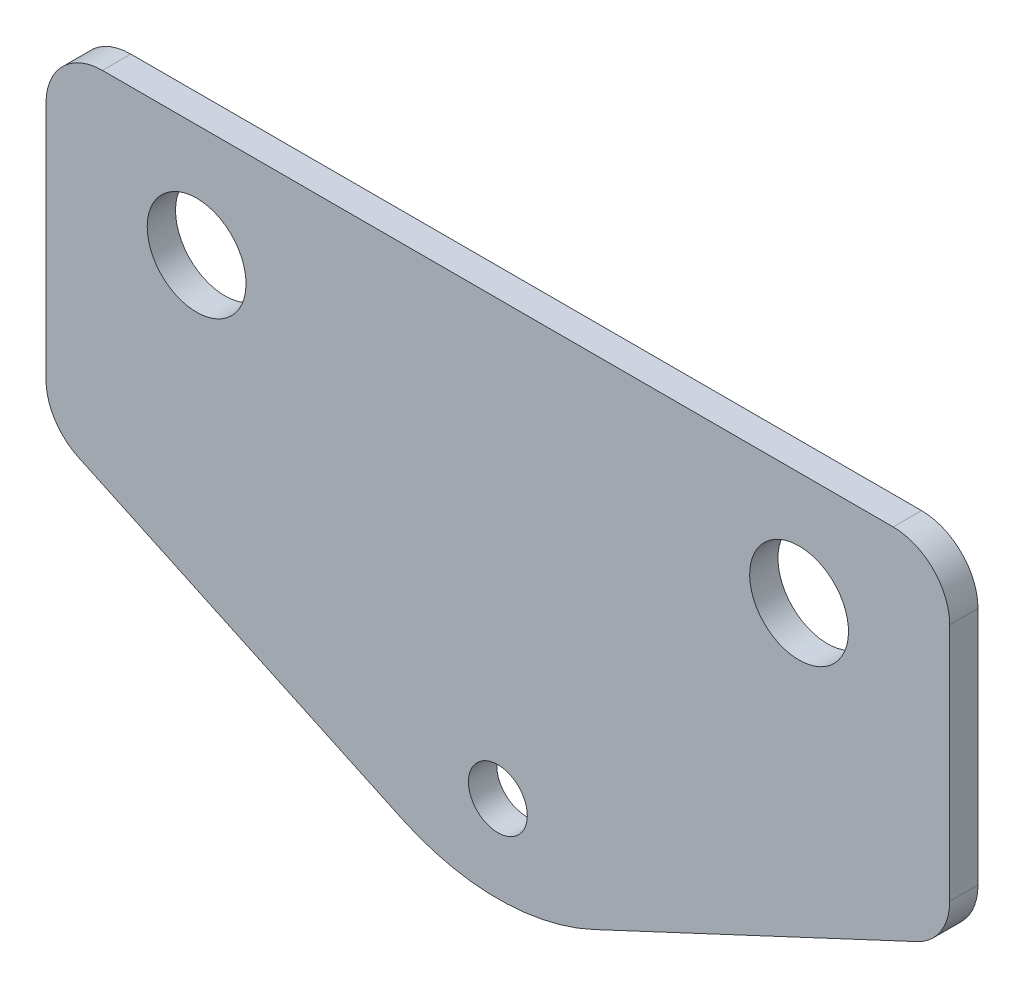
from build123d import *

# Parameters (mm, degrees)
BASE_FLANGE1_DEPTH    = 76.2
CUT_EXTRUDE1_DEPTH    = 100.11903454
SKETCH4_R             = 8.334375
CUT_EXTRUDE2_DEPTH    = 100.669004783
FILLET1_R             = 9.525
FLAT_PATTERN1_START   = 4.7752
FLAT_PATTERN1_DEPTH   = 41.610875653
FLAT_PATTERN1_2_DEPTH = 4.7752
SKETCH6_R             = 4.9657
CUT_EXTRUDE4_DEPTH    = 89.346165933


# Read off the part's stored shape, not the designer's step: Flat-Pattern1
# Sheet-metal steps are written as plain solids
with BuildPart() as part:
    # Sketch1 → Base-Flange1 (new, symmetric)
    with BuildSketch(Plane(origin=(0, 0, 0), x_dir=(0, 0, -1), z_dir=(1, 0, 0))):
        with BuildLine():
            Line((0, 44.45), (0, 3.610410109))
            ThreePointArc((0, 3.610410109), (-0.932488229, 0.652935287), (-3.392675737, -1.234832983))
            Line((-3.392675737, -1.234832983), (-44.752861065, -16.288709326))
            Line((-44.752861065, -16.288709326), (-46.386075653, -11.801489123))
            Line((-46.386075653, -11.801489123), (-5.025890325, 3.25238722))
            ThreePointArc((-5.025890325, 3.25238722), (-4.844103071, 3.391877486), (-4.7752, 3.610410109))
            Line((-4.7752, 3.610410109), (-4.7752, 44.45))
            Line((-4.7752, 44.45), (0, 44.45))
        make_face()
    extrude(amount=BASE_FLANGE1_DEPTH, both=True)

    # Sketch3 → Cut-Extrude1 (cut, through all)
    with BuildSketch(Plane(origin=(0, -7.918276224, 35.717035898), x_dir=(1, 0, 0), z_dir=(0, -0.9396926207859093, -0.3420201433256664))):
        with BuildLine():
            Line((-76.2, -20.318857819), (-16.138866151, 7.766752504))
            ThreePointArc((-16.138866151, 7.766752504), (0, 11.353754961), (16.138866151, 7.766752504))
            Line((16.138866151, 7.766752504), (76.2, -20.318857819))
            Line((76.2, -20.318857819), (88.840930233, -20.318857819))
            Line((88.840930233, -20.318857819), (88.840930233, 63.227466393))
            Line((88.840930233, 63.227466393), (-88.840930233, 63.227466393))
            Line((-88.840930233, 63.227466393), (-88.840930233, -20.318857819))
            Line((-88.840930233, -20.318857819), (-76.2, -20.318857819))
        make_face()
    extrude(amount=CUT_EXTRUDE1_DEPTH, mode=Mode.SUBTRACT)

    # Sketch4 → Cut-Extrude2 (cut, through all)
    with BuildSketch(Plane.XY):
        with Locations(Location((50.8, 25.4, 0), (0, 0, 90))):
            Circle(SKETCH4_R)
        with Locations(Location((-50.8, 25.4, 0), (0, 0, 180))):
            Circle(SKETCH4_R)
    extrude(amount=CUT_EXTRUDE2_DEPTH, mode=Mode.SUBTRACT)

    # Fillet1
    fillet1_edges = [part.edges().sort_by_distance(p)[0] for p in [
        (76.2, 44.45, 2.3876),
        (-76.2, -3.212427662, 15.806947849),
        (76.2, -3.212427662, 15.806947849),
        (-76.2, 44.45, 2.3876),
    ]]
    fillet(fillet1_edges, radius=FILLET1_R)

    # Flat-Pattern1 outline → Flat-Pattern1 (cut)
    with BuildSketch(Plane.XY.offset(FLAT_PATTERN1_START)):
        with BuildLine():
            ThreePointArc((70.709716538, -14.097999428), (74.711053136, -10.58321022), (76.2, -5.469750042))
            Line((76.2, -5.469750042), (76.2, 5))
            Line((76.2, 5), (-76.2, 5))
            Line((-76.2, 5), (-76.2, -5.469750042))
            ThreePointArc((-76.2, -5.469750042), (-74.711053136, -10.58321022), (-70.709716538, -14.097999428))
            Line((-70.709716538, -14.097999428), (-16.138866151, -39.616259585))
            ThreePointArc((-16.138866151, -39.616259585), (0, -43.203262043), (16.138866151, -39.616259585))
            Line((16.138866151, -39.616259585), (70.709716538, -14.097999428))
        make_face()
    extrude(amount=FLAT_PATTERN1_DEPTH, mode=Mode.SUBTRACT)

    # Flat-Pattern1 2 outline → Flat-Pattern1 2 (add)
    with BuildSketch(Plane.XY):
        with BuildLine():
            ThreePointArc((70.709716538, -14.097999428), (74.711053136, -10.58321022), (76.2, -5.469750042))
            Line((76.2, -5.469750042), (76.2, 5))
            Line((76.2, 5), (-76.2, 5))
            Line((-76.2, 5), (-76.2, -5.469750042))
            ThreePointArc((-76.2, -5.469750042), (-74.711053136, -10.58321022), (-70.709716538, -14.097999428))
            Line((-70.709716538, -14.097999428), (-16.138866151, -39.616259585))
            ThreePointArc((-16.138866151, -39.616259585), (0, -43.203262043), (16.138866151, -39.616259585))
            Line((16.138866151, -39.616259585), (70.709716538, -14.097999428))
        make_face()
    extrude(amount=FLAT_PATTERN1_2_DEPTH)

    # Sketch6 → Cut-Extrude4 (cut, through all)
    with BuildSketch(Plane.XY.offset(4.7752)):
        with Locations((0, -28.575)):
            Circle(SKETCH6_R)
    extrude(amount=-CUT_EXTRUDE4_DEPTH, mode=Mode.SUBTRACT)


solid = part.part
